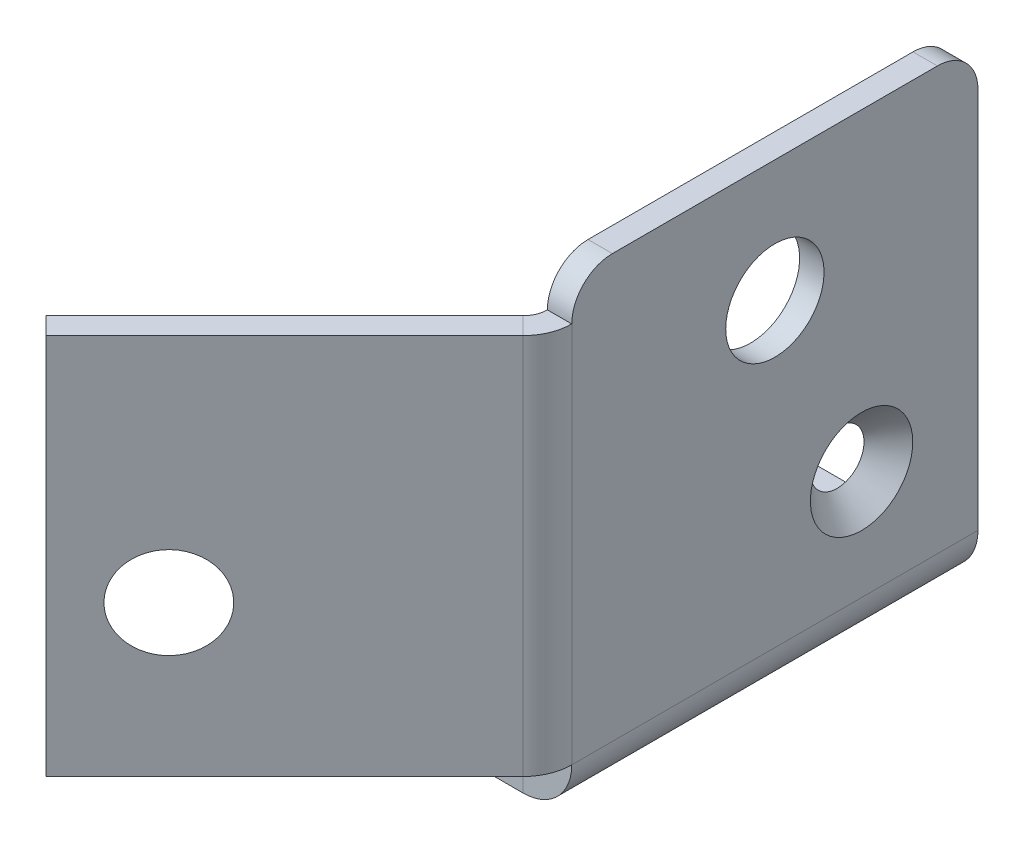
from build123d import *

# Parameters (mm, degrees)
BASE_FLANGE1_DEPTH                                  = 50
M12_CLEARANCE_HOLE1_D                               = 12.1
M6_CLEARANCE_HOLE1_D                                = 6.6
BREAK_CORNER1_START                                 = -3
BREAK_CORNER1_DEPTH                                 = 3
BREAK_CORNER1_2_DEPTH                               = 3
EDGE_FLANGE2_DEPTH                                  = 47
CSK_FOR_M8_COUNTERSUNK_FLAT_HEAD_SCREW1_D           = 9
CSK_FOR_M8_COUNTERSUNK_FLAT_HEAD_SCREW1_CSINK_D     = 17.3
CSK_FOR_M8_COUNTERSUNK_FLAT_HEAD_SCREW1_CSINK_ANGLE = 90
CSK_FOR_M6_COUNTERSUNK_FLAT_HEAD_SCREW1_D           = 6.6
CSK_FOR_M6_COUNTERSUNK_FLAT_HEAD_SCREW1_CSINK_D     = 12.6
CSK_FOR_M6_COUNTERSUNK_FLAT_HEAD_SCREW1_CSINK_ANGLE = 90


# Read off the part's stored shape, not the designer's step: Break-Corner1
# Sheet-metal steps are written as plain solids
with BuildPart() as part:
    # Sketch1 → Base-Flange1 (new body)
    with BuildSketch(Plane.XY):
        with BuildLine():
            Line((0, 55), (0, 3))
            ThreePointArc((0, 3), (-0.878679656, 0.878679656), (-3, 0))
            Line((-3, 0), (-30, 0))
            Line((-30, 0), (-30, -3))
            Line((-30, -3), (-3, -3))
            ThreePointArc((-3, -3), (1.242640687, -1.242640687), (3, 3))
            Line((3, 3), (3, 55))
            Line((3, 55), (0, 55))
        make_face()
    extrude(amount=BASE_FLANGE1_DEPTH)

    # M12 Clearance Hole1 (through all)
    with Locations(Plane.ZY):
        with Locations((25, 40)):
            Hole(M12_CLEARANCE_HOLE1_D / 2)

    # M6 Clearance Hole1 (through all)
    with Locations(Plane(origin=(0, 0, 0), x_dir=(1, 0, 0), z_dir=(0, 1, 0))):
        with Locations((-16.5, -40), (-16.5, -10)):
            Hole(M6_CLEARANCE_HOLE1_D / 2)

    # Break-Corner1 outline → Break-Corner1 (cut)
    with BuildSketch(Plane(origin=(0, 0, 0), x_dir=(1, 0, 0), z_dir=(0, 1, 0)).offset(BREAK_CORNER1_START)):
        with BuildLine():
            Line((-30, -50), (-25, -50))
            ThreePointArc((-25, -50), (-28.535533906, -48.535533906), (-30, -45))
            Line((-30, -45), (-30, -50))
        make_face()
        with BuildLine():
            Line((-30, 0), (-30, -5))
            ThreePointArc((-30, -5), (-28.535533906, -1.464466094), (-25, 0))
            Line((-25, 0), (-30, 0))
        make_face()
    extrude(amount=BREAK_CORNER1_DEPTH, mode=Mode.SUBTRACT)

    # Break-Corner1 2 outline → Break-Corner1 2 (cut)
    with BuildSketch(Plane.YZ):
        with BuildLine():
            Line((55, 0), (55, 5))
            ThreePointArc((55, 5), (53.535533906, 1.464466094), (50, 0))
            Line((50, 0), (55, 0))
        make_face()
        with BuildLine():
            ThreePointArc((50, 50), (53.535533906, 48.535533906), (55, 45))
            Line((55, 45), (55, 50))
            Line((55, 50), (50, 50))
        make_face()
    extrude(amount=BREAK_CORNER1_2_DEPTH, mode=Mode.SUBTRACT)

    # Edge-Flange2 section (across the edge) → Edge-Flange2 (add)
    with BuildSketch(Plane(origin=(0, 3, 51.242640687), x_dir=(-0.7071067811865512, 0, -0.7071067811865438), z_dir=(0, 1, 0))):
        with BuildLine():
            Line((-3, 1.242640687), (-3, 42.757359313))
            Line((-3, 42.757359313), (0, 42.757359313))
            Line((0, 42.757359313), (0, 1.242640687))
            ThreePointArc((0, 1.242640687), (0.228361402, 0.09459039), (0.878679656, -0.878679656))
            Line((0.878679656, -0.878679656), (-1.242640687, -3))
            ThreePointArc((-1.242640687, -3), (-2.543277195, -1.053459907), (-3, 1.242640687))
        make_face()
    extrude(amount=EDGE_FLANGE2_DEPTH)

    # CSK for M8 Countersunk Flat Head Screw1 (through all)
    with Locations(Plane(origin=(25.621320344, 0, 25.621320344), x_dir=(-0.7071067811865437, 0, 0.7071067811865513), z_dir=(-0.7071067811865513, 0, -0.7071067811865437))):
        with Locations((68.299943249, 21.537354557)):
            CounterSinkHole(CSK_FOR_M8_COUNTERSUNK_FLAT_HEAD_SCREW1_D / 2, CSK_FOR_M8_COUNTERSUNK_FLAT_HEAD_SCREW1_CSINK_D / 2, counter_sink_angle=CSK_FOR_M8_COUNTERSUNK_FLAT_HEAD_SCREW1_CSINK_ANGLE)

    # CSK for M6 Countersunk Flat Head Screw1 (through all)
    with Locations(Plane(origin=(3, 0, 0), x_dir=(0, 0, -1), z_dir=(1, 0, 0))):
        with Locations((-14.330047328, 16.438814783)):
            CounterSinkHole(CSK_FOR_M6_COUNTERSUNK_FLAT_HEAD_SCREW1_D / 2, CSK_FOR_M6_COUNTERSUNK_FLAT_HEAD_SCREW1_CSINK_D / 2, counter_sink_angle=CSK_FOR_M6_COUNTERSUNK_FLAT_HEAD_SCREW1_CSINK_ANGLE)


solid = part.part
